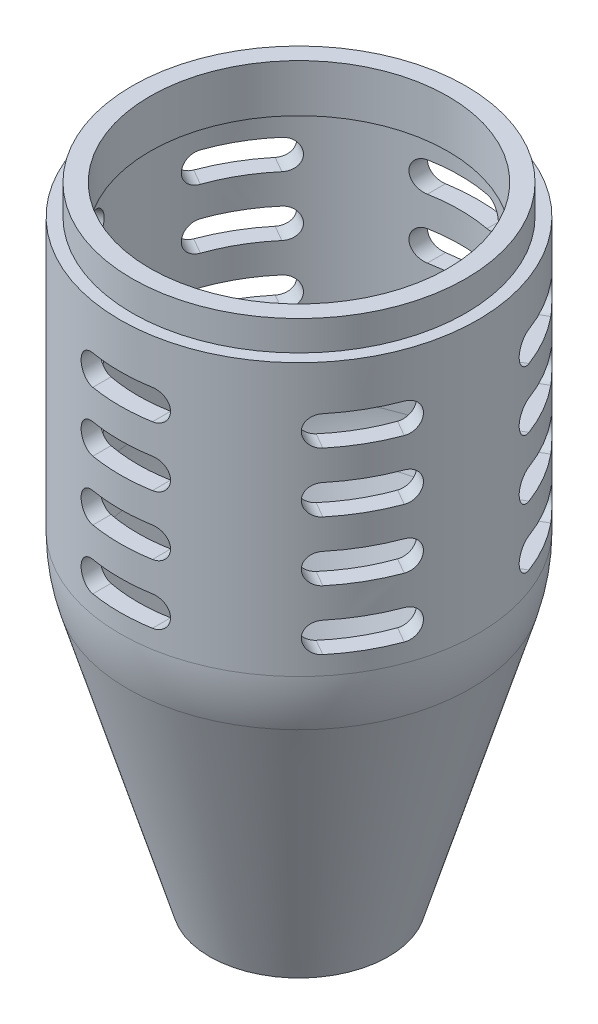
from build123d import *
from build123d.topology import SkipClean

# Parameters (mm, degrees)
SKETCH2_R                        = 28
SKETCH2_R_2                      = 25
EXTRUDE_THIN1_DEPTH              = 5
CUT_EXTRUDE_1_DEPTH              = 114.247516529
PATTERN_LINEAR_3_COUNT           = 4
PATTERN_LINEAR_3_PITCH           = 10
PATTERN_CIRCULAR_1_COUNT         = 6
PATTERN_CIRCULAR_1_COPY_1_DEPTH  = 114.247516529
PATTERN_CIRCULAR_1_COPY_2_DEPTH  = 114.247516529
PATTERN_CIRCULAR_1_COPY_3_DEPTH  = 114.247516529
PATTERN_CIRCULAR_1_COPY_4_DEPTH  = 114.247516529
PATTERN_CIRCULAR_1_COPY_5_DEPTH  = 114.247516529
PATTERN_CIRCULAR_1_COPY_6_DEPTH  = 114.247516529
PATTERN_CIRCULAR_1_COPY_7_DEPTH  = 114.247516529
PATTERN_CIRCULAR_1_COPY_8_DEPTH  = 114.247516529
PATTERN_CIRCULAR_1_COPY_9_DEPTH  = 114.247516529
PATTERN_CIRCULAR_1_COPY_10_DEPTH = 114.247516529
PATTERN_CIRCULAR_1_COPY_11_DEPTH = 114.247516529
PATTERN_CIRCULAR_1_COPY_12_DEPTH = 114.247516529
PATTERN_CIRCULAR_1_COPY_13_DEPTH = 114.247516529
PATTERN_CIRCULAR_1_COPY_14_DEPTH = 114.247516529
PATTERN_CIRCULAR_1_COPY_15_DEPTH = 114.247516529


# Read off the part's stored shape, not the designer's step: Shell2
with BuildPart() as part:
    # Sketch1 → Revolve1 (revolve)
    with BuildSketch(Plane.XY, mode=Mode.PRIVATE) as revolve1_sk:
        with BuildLine():
            Line((0, 0), (0, 100))
            Line((0, 100), (30, 100))
            Line((30, 100), (30, 54.403065089))
            ThreePointArc((30, 54.403065089), (29.682011865, 50.046670749), (28.734788557, 45.782628522))
            Line((28.734788557, 45.782628522), (15, 0))
            Line((15, 0), (0, 0))
        make_face()
    revolve(revolve1_sk.sketch.rotate(Axis((0, 126.662122273, 0), (0, -1, 0)), 90), axis=Axis((0, 126.662122273, 0), (0, -1, 0)))

    # Sketch2 → Extrude-Thin1 (add)
    with BuildSketch(Plane(origin=(0, 100, 0), x_dir=(-1, 0, 0), z_dir=(0, 1, 0))):
        Circle(SKETCH2_R)
        Circle(SKETCH2_R_2, mode=Mode.SUBTRACT)
    extrude(amount=EXTRUDE_THIN1_DEPTH)

    # Shell2 outline → Shell2 (revolve, cut)
    with SkipClean():  # the faces are left unmerged after this step: merging them gives an invalid solid
        with BuildSketch(Plane.XY):
            with BuildLine():
                Line((25, 97), (25, 100))
                Line((25, 100), (0, 100))
                Line((0, 100), (0, 0))
                Line((0, 0), (11.867908047, 0))
                Line((11.867908047, 0), (25.861309693, 46.644672153))
                ThreePointArc((25.861309693, 46.644672153), (26.713810678, 50.482310183), (27, 54.403065116))
                Line((27, 54.403065116), (27, 97))
                Line((27, 97), (25, 97))
            make_face()
        revolve(axis=Axis((0, 0, 0), (0, 1, 0)), mode=Mode.SUBTRACT)

    # Эскиз1 → Вырез-Вытянуть1 (cut, through all)
    with SkipClean():  # the faces are left unmerged after this step: merging them gives an invalid solid
        with BuildSketch(Plane.XY):
            with BuildLine():
                Line((-5, 62.5), (5, 62.5))
                ThreePointArc((5, 62.5), (7.5, 60), (5, 57.5))
                Line((5, 57.5), (-5, 57.5))
                ThreePointArc((-5, 57.5), (-7.5, 60), (-5, 62.5))
            make_face()
        cut_extrude_1 = extrude(amount=-CUT_EXTRUDE_1_DEPTH, mode=Mode.SUBTRACT)

    # Линейный массив3: Вырез-Вытянуть1 ×4
    with SkipClean():  # the faces are left unmerged after this step: merging them gives an invalid solid
        with Locations(*[(0, i * PATTERN_LINEAR_3_PITCH, 0) for i in range(1, PATTERN_LINEAR_3_COUNT)]):
            add(cut_extrude_1, mode=Mode.SUBTRACT)

    # Круговой массив1: Вырез-Вытянуть1 ×6 about axis
    with SkipClean():  # the faces are left unmerged after this step: merging them gives an invalid solid
        pattern_circular_1_axis = Axis((0, 126.662122273, 0), (0, 1, 0))
        for i in range(1, PATTERN_CIRCULAR_1_COUNT):
            add(cut_extrude_1.rotate(pattern_circular_1_axis, i * 360 / PATTERN_CIRCULAR_1_COUNT), mode=Mode.SUBTRACT)

    # Круговой массив1 copy 1 sketch → Круговой массив1 copy 1 (cut, through all)
    with SkipClean():  # the faces are left unmerged after this step: merging them gives an invalid solid
        with BuildSketch(Plane(origin=(0, 10, 0), x_dir=(0.5000000000000001, 0, -0.8660254037844386), z_dir=(0.8660254037844386, 0, 0.5000000000000001))):
            with BuildLine():
                Line((-5, 62.5), (5, 62.5))
                ThreePointArc((5, 62.5), (7.5, 60), (5, 57.5))
                Line((5, 57.5), (-5, 57.5))
                ThreePointArc((-5, 57.5), (-7.5, 60), (-5, 62.5))
            make_face()
        extrude(amount=-PATTERN_CIRCULAR_1_COPY_1_DEPTH, mode=Mode.SUBTRACT)

    # Круговой массив1 copy 2 sketch → Круговой массив1 copy 2 (cut, through all)
    with SkipClean():  # the faces are left unmerged after this step: merging them gives an invalid solid
        with BuildSketch(Plane(origin=(0, 10, 0), x_dir=(-0.4999999999999998, 0, -0.8660254037844387), z_dir=(0.8660254037844387, 0, -0.4999999999999998))):
            with BuildLine():
                Line((-5, 62.5), (5, 62.5))
                ThreePointArc((5, 62.5), (7.5, 60), (5, 57.5))
                Line((5, 57.5), (-5, 57.5))
                ThreePointArc((-5, 57.5), (-7.5, 60), (-5, 62.5))
            make_face()
        extrude(amount=-PATTERN_CIRCULAR_1_COPY_2_DEPTH, mode=Mode.SUBTRACT)

    # Круговой массив1 copy 3 sketch → Круговой массив1 copy 3 (cut, through all)
    with SkipClean():  # the faces are left unmerged after this step: merging them gives an invalid solid
        with BuildSketch(Plane(origin=(0, 10, 0), x_dir=(-1, 0, 0), z_dir=(0, 0, -1))):
            with BuildLine():
                Line((-5, 62.5), (5, 62.5))
                ThreePointArc((5, 62.5), (7.5, 60), (5, 57.5))
                Line((5, 57.5), (-5, 57.5))
                ThreePointArc((-5, 57.5), (-7.5, 60), (-5, 62.5))
            make_face()
        extrude(amount=-PATTERN_CIRCULAR_1_COPY_3_DEPTH, mode=Mode.SUBTRACT)

    # Круговой массив1 copy 4 sketch → Круговой массив1 copy 4 (cut, through all)
    with SkipClean():  # the faces are left unmerged after this step: merging them gives an invalid solid
        with BuildSketch(Plane(origin=(0, 10, 0), x_dir=(-0.5000000000000004, 0, 0.8660254037844384), z_dir=(-0.8660254037844384, 0, -0.5000000000000004))):
            with BuildLine():
                Line((-5, 62.5), (5, 62.5))
                ThreePointArc((5, 62.5), (7.5, 60), (5, 57.5))
                Line((5, 57.5), (-5, 57.5))
                ThreePointArc((-5, 57.5), (-7.5, 60), (-5, 62.5))
            make_face()
        extrude(amount=-PATTERN_CIRCULAR_1_COPY_4_DEPTH, mode=Mode.SUBTRACT)

    # Круговой массив1 copy 5 sketch → Круговой массив1 copy 5 (cut, through all)
    with SkipClean():  # the faces are left unmerged after this step: merging them gives an invalid solid
        with BuildSketch(Plane(origin=(0, 10, 0), x_dir=(0.5000000000000001, 0, 0.8660254037844386), z_dir=(-0.8660254037844386, 0, 0.5000000000000001))):
            with BuildLine():
                Line((-5, 62.5), (5, 62.5))
                ThreePointArc((5, 62.5), (7.5, 60), (5, 57.5))
                Line((5, 57.5), (-5, 57.5))
                ThreePointArc((-5, 57.5), (-7.5, 60), (-5, 62.5))
            make_face()
        extrude(amount=-PATTERN_CIRCULAR_1_COPY_5_DEPTH, mode=Mode.SUBTRACT)

    # Круговой массив1 copy 6 sketch → Круговой массив1 copy 6 (cut, through all)
    with SkipClean():  # the faces are left unmerged after this step: merging them gives an invalid solid
        with BuildSketch(Plane(origin=(0, 20, 0), x_dir=(0.5000000000000001, 0, -0.8660254037844386), z_dir=(0.8660254037844386, 0, 0.5000000000000001))):
            with BuildLine():
                Line((-5, 62.5), (5, 62.5))
                ThreePointArc((5, 62.5), (7.5, 60), (5, 57.5))
                Line((5, 57.5), (-5, 57.5))
                ThreePointArc((-5, 57.5), (-7.5, 60), (-5, 62.5))
            make_face()
        extrude(amount=-PATTERN_CIRCULAR_1_COPY_6_DEPTH, mode=Mode.SUBTRACT)

    # Круговой массив1 copy 7 sketch → Круговой массив1 copy 7 (cut, through all)
    with SkipClean():  # the faces are left unmerged after this step: merging them gives an invalid solid
        with BuildSketch(Plane(origin=(0, 20, 0), x_dir=(-0.4999999999999998, 0, -0.8660254037844387), z_dir=(0.8660254037844387, 0, -0.4999999999999998))):
            with BuildLine():
                Line((-5, 62.5), (5, 62.5))
                ThreePointArc((5, 62.5), (7.5, 60), (5, 57.5))
                Line((5, 57.5), (-5, 57.5))
                ThreePointArc((-5, 57.5), (-7.5, 60), (-5, 62.5))
            make_face()
        extrude(amount=-PATTERN_CIRCULAR_1_COPY_7_DEPTH, mode=Mode.SUBTRACT)

    # Круговой массив1 copy 8 sketch → Круговой массив1 copy 8 (cut, through all)
    with SkipClean():  # the faces are left unmerged after this step: merging them gives an invalid solid
        with BuildSketch(Plane(origin=(0, 20, 0), x_dir=(-1, 0, 0), z_dir=(0, 0, -1))):
            with BuildLine():
                Line((-5, 62.5), (5, 62.5))
                ThreePointArc((5, 62.5), (7.5, 60), (5, 57.5))
                Line((5, 57.5), (-5, 57.5))
                ThreePointArc((-5, 57.5), (-7.5, 60), (-5, 62.5))
            make_face()
        extrude(amount=-PATTERN_CIRCULAR_1_COPY_8_DEPTH, mode=Mode.SUBTRACT)

    # Круговой массив1 copy 9 sketch → Круговой массив1 copy 9 (cut, through all)
    with SkipClean():  # the faces are left unmerged after this step: merging them gives an invalid solid
        with BuildSketch(Plane(origin=(0, 20, 0), x_dir=(-0.5000000000000004, 0, 0.8660254037844384), z_dir=(-0.8660254037844384, 0, -0.5000000000000004))):
            with BuildLine():
                Line((-5, 62.5), (5, 62.5))
                ThreePointArc((5, 62.5), (7.5, 60), (5, 57.5))
                Line((5, 57.5), (-5, 57.5))
                ThreePointArc((-5, 57.5), (-7.5, 60), (-5, 62.5))
            make_face()
        extrude(amount=-PATTERN_CIRCULAR_1_COPY_9_DEPTH, mode=Mode.SUBTRACT)

    # Круговой массив1 copy 10 sketch → Круговой массив1 copy 10 (cut, through all)
    with SkipClean():  # the faces are left unmerged after this step: merging them gives an invalid solid
        with BuildSketch(Plane(origin=(0, 20, 0), x_dir=(0.5000000000000001, 0, 0.8660254037844386), z_dir=(-0.8660254037844386, 0, 0.5000000000000001))):
            with BuildLine():
                Line((-5, 62.5), (5, 62.5))
                ThreePointArc((5, 62.5), (7.5, 60), (5, 57.5))
                Line((5, 57.5), (-5, 57.5))
                ThreePointArc((-5, 57.5), (-7.5, 60), (-5, 62.5))
            make_face()
        extrude(amount=-PATTERN_CIRCULAR_1_COPY_10_DEPTH, mode=Mode.SUBTRACT)

    # Круговой массив1 copy 11 sketch → Круговой массив1 copy 11 (cut, through all)
    with SkipClean():  # the faces are left unmerged after this step: merging them gives an invalid solid
        with BuildSketch(Plane(origin=(0, 30, 0), x_dir=(0.5000000000000001, 0, -0.8660254037844386), z_dir=(0.8660254037844386, 0, 0.5000000000000001))):
            with BuildLine():
                Line((-5, 62.5), (5, 62.5))
                ThreePointArc((5, 62.5), (7.5, 60), (5, 57.5))
                Line((5, 57.5), (-5, 57.5))
                ThreePointArc((-5, 57.5), (-7.5, 60), (-5, 62.5))
            make_face()
        extrude(amount=-PATTERN_CIRCULAR_1_COPY_11_DEPTH, mode=Mode.SUBTRACT)

    # Круговой массив1 copy 12 sketch → Круговой массив1 copy 12 (cut, through all)
    with SkipClean():  # the faces are left unmerged after this step: merging them gives an invalid solid
        with BuildSketch(Plane(origin=(0, 30, 0), x_dir=(-0.4999999999999998, 0, -0.8660254037844387), z_dir=(0.8660254037844387, 0, -0.4999999999999998))):
            with BuildLine():
                Line((-5, 62.5), (5, 62.5))
                ThreePointArc((5, 62.5), (7.5, 60), (5, 57.5))
                Line((5, 57.5), (-5, 57.5))
                ThreePointArc((-5, 57.5), (-7.5, 60), (-5, 62.5))
            make_face()
        extrude(amount=-PATTERN_CIRCULAR_1_COPY_12_DEPTH, mode=Mode.SUBTRACT)

    # Круговой массив1 copy 13 sketch → Круговой массив1 copy 13 (cut, through all)
    with SkipClean():  # the faces are left unmerged after this step: merging them gives an invalid solid
        with BuildSketch(Plane(origin=(0, 30, 0), x_dir=(-1, 0, 0), z_dir=(0, 0, -1))):
            with BuildLine():
                Line((-5, 62.5), (5, 62.5))
                ThreePointArc((5, 62.5), (7.5, 60), (5, 57.5))
                Line((5, 57.5), (-5, 57.5))
                ThreePointArc((-5, 57.5), (-7.5, 60), (-5, 62.5))
            make_face()
        extrude(amount=-PATTERN_CIRCULAR_1_COPY_13_DEPTH, mode=Mode.SUBTRACT)

    # Круговой массив1 copy 14 sketch → Круговой массив1 copy 14 (cut, through all)
    with SkipClean():  # the faces are left unmerged after this step: merging them gives an invalid solid
        with BuildSketch(Plane(origin=(0, 30, 0), x_dir=(-0.5000000000000004, 0, 0.8660254037844384), z_dir=(-0.8660254037844384, 0, -0.5000000000000004))):
            with BuildLine():
                Line((-5, 62.5), (5, 62.5))
                ThreePointArc((5, 62.5), (7.5, 60), (5, 57.5))
                Line((5, 57.5), (-5, 57.5))
                ThreePointArc((-5, 57.5), (-7.5, 60), (-5, 62.5))
            make_face()
        extrude(amount=-PATTERN_CIRCULAR_1_COPY_14_DEPTH, mode=Mode.SUBTRACT)

    # Круговой массив1 copy 15 sketch → Круговой массив1 copy 15 (cut, through all)
    with SkipClean():  # the faces are left unmerged after this step: merging them gives an invalid solid
        with BuildSketch(Plane(origin=(0, 30, 0), x_dir=(0.5000000000000001, 0, 0.8660254037844386), z_dir=(-0.8660254037844386, 0, 0.5000000000000001))):
            with BuildLine():
                Line((-5, 62.5), (5, 62.5))
                ThreePointArc((5, 62.5), (7.5, 60), (5, 57.5))
                Line((5, 57.5), (-5, 57.5))
                ThreePointArc((-5, 57.5), (-7.5, 60), (-5, 62.5))
            make_face()
        extrude(amount=-PATTERN_CIRCULAR_1_COPY_15_DEPTH, mode=Mode.SUBTRACT)


solid = part.part
